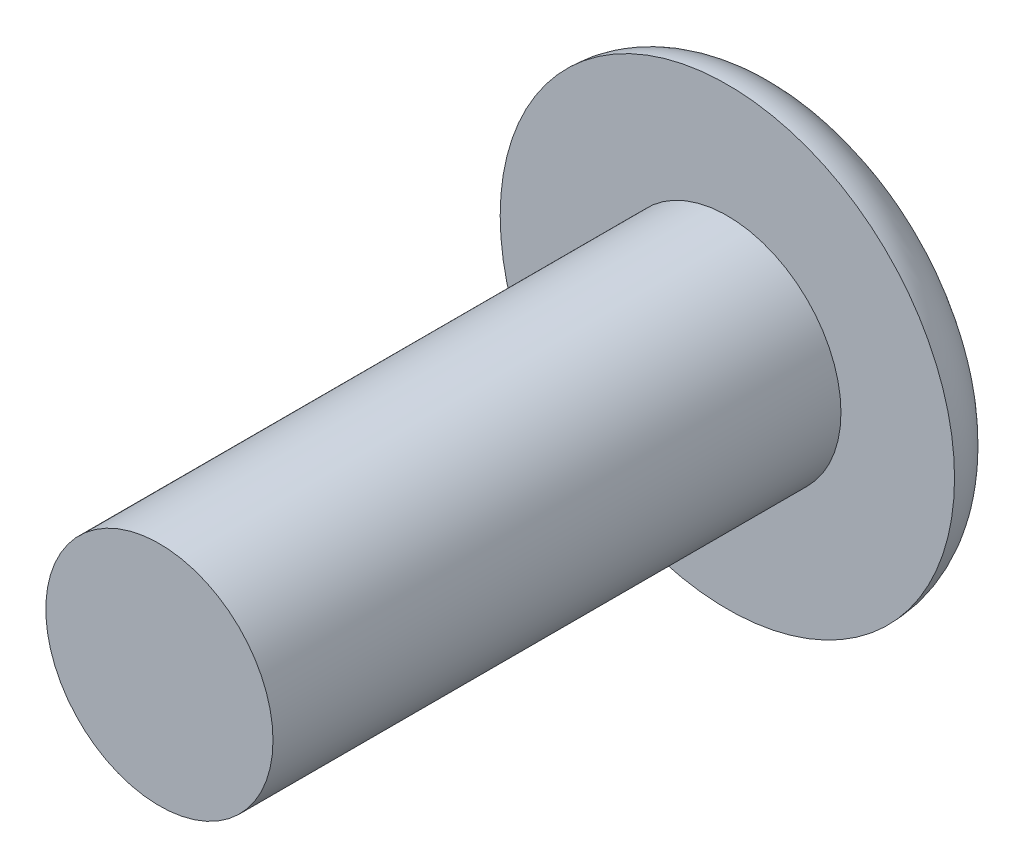
from build123d import *

# Parameters (mm, degrees)
SKETCH1_R           = 4
BOSS_EXTRUDE1_DEPTH = 1
SKETCH2_R           = 2
BOSS_EXTRUDE2_DEPTH = 10
FILLET2_R           = 1


with BuildPart() as part:
    # Sketch1 → Boss-Extrude1 (new body)
    with BuildSketch(Plane.XY):
        Circle(SKETCH1_R)
    extrude(amount=BOSS_EXTRUDE1_DEPTH)

    # Sketch2 → Boss-Extrude2 (add)
    with BuildSketch(Plane.XY.offset(1)):
        Circle(SKETCH2_R)
    extrude(amount=BOSS_EXTRUDE2_DEPTH)

    # Fillet2
    fillet2_edges = [part.edges().sort_by_distance(p)[0] for p in [
        (-4, 0, 0),
    ]]
    fillet(fillet2_edges, radius=FILLET2_R - 0.0001)  # a hair under: the kernel refuses the full size


solid = part.part
